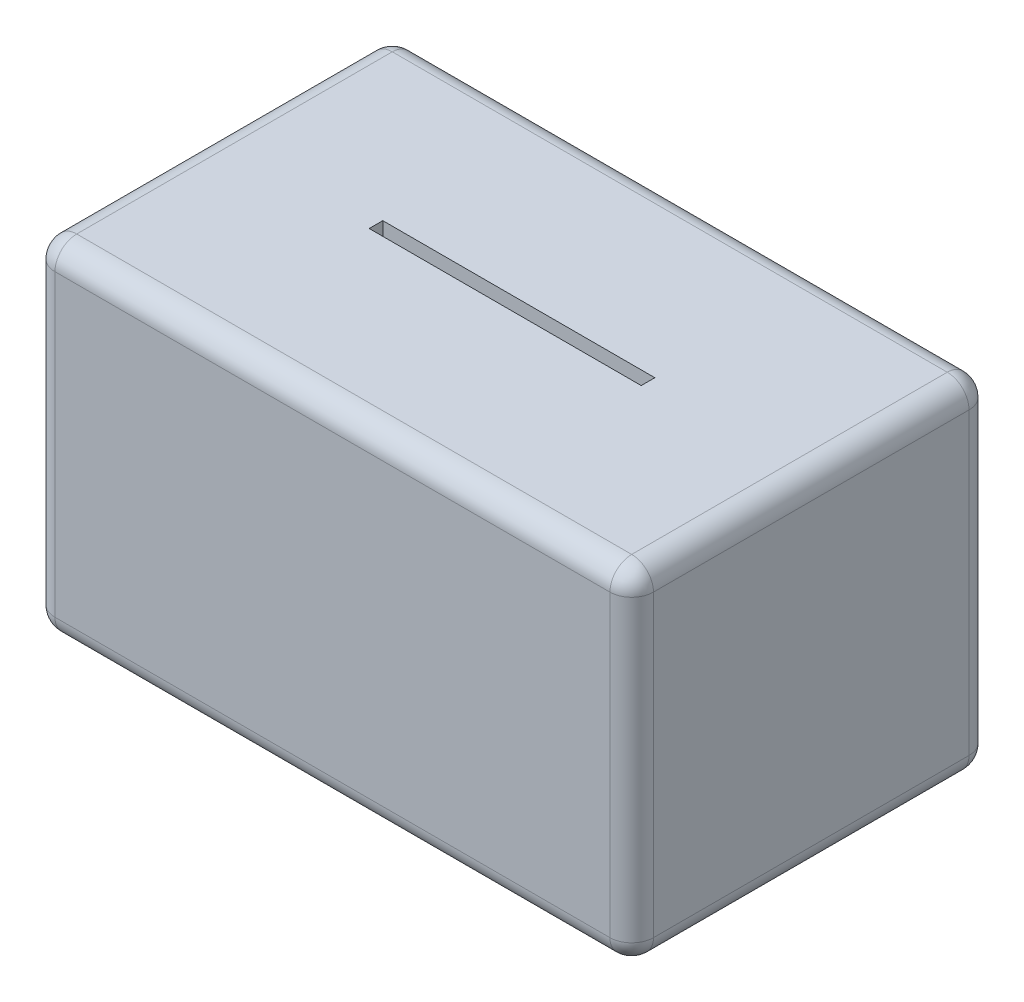
from build123d import *

# Parameters (mm, degrees)
SKETCH1_W           = 100
SKETCH1_H           = 60
BOSS_EXTRUDE1_DEPTH = 60
BOSS_EXTRUDE1_TAPER = 1
SHELL1_T            = -3
CHAMFER1_SIZE       = 2
CHAMFER1_SIZE_2     = 1.166633397
SKETCH2_W           = 100
SKETCH2_H           = 60
BOSS_EXTRUDE2_DEPTH = 3
SKETCH3_W           = 110
SKETCH3_H           = 66
SKETCH3_W_2         = 100
SKETCH3_H_2         = 60
BOSS_EXTRUDE3_DEPTH = 63
SKETCH4_W           = 50
SKETCH4_H           = 2.5
CUT_EXTRUDE1_DEPTH  = 3
FILLET1_R           = 4


with BuildPart() as part:
    # Sketch1 → Boss-Extrude1 (new body)
    with BuildSketch(Plane(origin=(0, 0, 0), x_dir=(1, 0, 0), z_dir=(0, 1, 0))):
        with Locations((50, 30)):
            Rectangle(SKETCH1_W, SKETCH1_H)
    extrude(amount=BOSS_EXTRUDE1_DEPTH, taper=BOSS_EXTRUDE1_TAPER)

    # Shell1
    shell1_openings = [part.faces().sort_by_distance(p)[0] for p in [
        (50, 60, -30),
    ]]
    offset(amount=SHELL1_T, openings=shell1_openings, kind=Kind.INTERSECTION)

    # Chamfer1
    # the kernel refuses this chamfer: 2, 1.166633397 mm, written as the material it takes off along each edge
    with BuildSketch(Plane(origin=(98.952696104, 60, 4.126867614), x_dir=(0.03677296874035604, -0.9993236456574119, 0), z_dir=(0, 0, -1)), Plane(origin=(1.047303896, 60, -64.126867614), x_dir=(-0.036772968740354815, -0.9993236456574122, 0), z_dir=(0, 0, 1))) as chamfer1_piece_1:
        Polygon((CHAMFER1_SIZE * 0.999813220622, CHAMFER1_SIZE * 0.0193267656127), (-CHAMFER1_SIZE_2 * 0.0367729687471, CHAMFER1_SIZE_2 * 0.999323645842), (0, 0), align=None)
    extrude(amount=68.253735227, mode=Mode.SUBTRACT)
    with BuildSketch(Plane(origin=(104.126867614, 60, -58.952696104), x_dir=(0, -0.9993236456574122, -0.036772968740352616), z_dir=(-1, 0, 0)), Plane(origin=(-4.126867614, 60, -1.047303896), x_dir=(0, -0.9993236456574119, 0.03677296874035481), z_dir=(1, 0, 0))) as chamfer1_piece_2:
        Polygon((CHAMFER1_SIZE * 0.999813220622, CHAMFER1_SIZE * 0.0193267656127), (-CHAMFER1_SIZE_2 * 0.0367729687471, CHAMFER1_SIZE_2 * 0.999323645842), (0, 0), align=None)
    extrude(amount=108.253735227, mode=Mode.SUBTRACT)


with BuildPart() as body_2:
    # Sketch2 → Boss-Extrude2 (new body)
    with BuildSketch(Plane(origin=(0, 60.2, 0), x_dir=(1, 0, 0), z_dir=(0, 1, 0))):
        with Locations((50, 30)):
            Rectangle(SKETCH2_W, SKETCH2_H)
    extrude(amount=BOSS_EXTRUDE2_DEPTH)


with BuildPart() as body_3:
    # Sketch3 → Boss-Extrude3 (new body)
    with BuildSketch(Plane(origin=(0, 63.2, 0), x_dir=(1, 0, 0), z_dir=(0, 1, 0))):
        with Locations((50, 30)):
            Rectangle(SKETCH3_W, SKETCH3_H)
        with Locations((50, 30)):
            Rectangle(SKETCH3_W_2, SKETCH3_H_2, mode=Mode.SUBTRACT)
    extrude(amount=-BOSS_EXTRUDE3_DEPTH)


with BuildPart() as body_2_1:
    add(body_2.part)

    # Combine1: union body 3
    add(body_3.part)

    # Sketch4 → Cut-Extrude1 (cut)
    with BuildSketch(Plane(origin=(0, 63.2, 0), x_dir=(1, 0, 0), z_dir=(0, 1, 0))):
        with Locations((50, 30)):
            Rectangle(SKETCH4_W, SKETCH4_H)
    extrude(amount=-CUT_EXTRUDE1_DEPTH, mode=Mode.SUBTRACT)

    # Fillet1
    # the kernel refuses this fillet: 4 mm, written as the material it takes off along each edge
    with BuildSketch(Plane(origin=(101, 4.2, -59), x_dir=(0, 0, -1), z_dir=(0, -1, 0))) as fillet1_piece_1_section:
        Polygon((0, 0), (FILLET1_R, 0), (FILLET1_R, FILLET1_R), (0, FILLET1_R), align=None)
    fillet1_piece_1 = extrude(amount=FILLET1_R, mode=Mode.PRIVATE)
    fillet1_piece_1 = fillet1_piece_1 - Plane(origin=(101, 4.2, -59), x_dir=(-0.7071067811865475, 0, 0.7071067811865475), z_dir=(0, -1, 0)) * Sphere(FILLET1_R, mode=Mode.PRIVATE)
    add(fillet1_piece_1, mode=Mode.SUBTRACT)
    with BuildSketch(Plane(origin=(101, 4.2, -1), x_dir=(1, 0, 0), z_dir=(0, -1, 0))) as fillet1_piece_2_section:
        Polygon((0, 0), (FILLET1_R, 0), (FILLET1_R, FILLET1_R), (0, FILLET1_R), align=None)
    fillet1_piece_2 = extrude(amount=FILLET1_R, mode=Mode.PRIVATE)
    fillet1_piece_2 = fillet1_piece_2 - Plane(origin=(101, 4.2, -1), x_dir=(-0.7071067811865475, 0, -0.7071067811865475), z_dir=(0, -1, 0)) * Sphere(FILLET1_R, mode=Mode.PRIVATE)
    add(fillet1_piece_2, mode=Mode.SUBTRACT)
    with BuildSketch(Plane(origin=(101, 59.2, -59), x_dir=(0, 0, -1), z_dir=(0, 1, 0))) as fillet1_piece_3_section:
        Polygon((0, 0), (FILLET1_R, 0), (FILLET1_R, -FILLET1_R), (0, -FILLET1_R), align=None)
    fillet1_piece_3 = extrude(amount=FILLET1_R, mode=Mode.PRIVATE)
    fillet1_piece_3 = fillet1_piece_3 - Plane(origin=(101, 59.2, -59), x_dir=(-0.7071067811865475, 0, 0.7071067811865475), z_dir=(0, 1, 0)) * Sphere(FILLET1_R, mode=Mode.PRIVATE)
    add(fillet1_piece_3, mode=Mode.SUBTRACT)
    with BuildSketch(Plane(origin=(101, 59.2, -1), x_dir=(1, 0, 0), z_dir=(0, 1, 0))) as fillet1_piece_4_section:
        Polygon((0, 0), (FILLET1_R, 0), (FILLET1_R, -FILLET1_R), (0, -FILLET1_R), align=None)
    fillet1_piece_4 = extrude(amount=FILLET1_R, mode=Mode.PRIVATE)
    fillet1_piece_4 = fillet1_piece_4 - Plane(origin=(101, 59.2, -1), x_dir=(-0.7071067811865475, 0, -0.7071067811865475), z_dir=(0, 1, 0)) * Sphere(FILLET1_R, mode=Mode.PRIVATE)
    add(fillet1_piece_4, mode=Mode.SUBTRACT)
    with BuildSketch(Plane(origin=(-1, 4.2, -1), x_dir=(0, 0, 1), z_dir=(0, -1, 0))) as fillet1_piece_5_section:
        Polygon((0, 0), (FILLET1_R, 0), (FILLET1_R, FILLET1_R), (0, FILLET1_R), align=None)
    fillet1_piece_5 = extrude(amount=FILLET1_R, mode=Mode.PRIVATE)
    fillet1_piece_5 = fillet1_piece_5 - Plane(origin=(-1, 4.2, -1), x_dir=(0.7071067811865475, 0, -0.7071067811865475), z_dir=(0, -1, 0)) * Sphere(FILLET1_R, mode=Mode.PRIVATE)
    add(fillet1_piece_5, mode=Mode.SUBTRACT)
    with BuildSketch(Plane(origin=(-1, 59.2, -1), x_dir=(0, 0, 1), z_dir=(0, 1, 0))) as fillet1_piece_6_section:
        Polygon((0, 0), (FILLET1_R, 0), (FILLET1_R, -FILLET1_R), (0, -FILLET1_R), align=None)
    fillet1_piece_6 = extrude(amount=FILLET1_R, mode=Mode.PRIVATE)
    fillet1_piece_6 = fillet1_piece_6 - Plane(origin=(-1, 59.2, -1), x_dir=(0.7071067811865475, 0, -0.7071067811865475), z_dir=(0, 1, 0)) * Sphere(FILLET1_R, mode=Mode.PRIVATE)
    add(fillet1_piece_6, mode=Mode.SUBTRACT)
    with BuildSketch(Plane(origin=(-1, 4.2, -59), x_dir=(0, 0, -1), z_dir=(0, -1, 0))) as fillet1_piece_7_section:
        Polygon((0, 0), (FILLET1_R, 0), (FILLET1_R, -FILLET1_R), (0, -FILLET1_R), align=None)
    fillet1_piece_7 = extrude(amount=FILLET1_R, mode=Mode.PRIVATE)
    fillet1_piece_7 = fillet1_piece_7 - Plane(origin=(-1, 4.2, -59), x_dir=(0.7071067811865475, 0, 0.7071067811865475), z_dir=(0, -1, 0)) * Sphere(FILLET1_R, mode=Mode.PRIVATE)
    add(fillet1_piece_7, mode=Mode.SUBTRACT)
    with BuildSketch(Plane(origin=(-1, 59.2, -59), x_dir=(0, 0, -1), z_dir=(0, 1, 0))) as fillet1_piece_8_section:
        Polygon((0, 0), (FILLET1_R, 0), (FILLET1_R, FILLET1_R), (0, FILLET1_R), align=None)
    fillet1_piece_8 = extrude(amount=FILLET1_R, mode=Mode.PRIVATE)
    fillet1_piece_8 = fillet1_piece_8 - Plane(origin=(-1, 59.2, -59), x_dir=(0.7071067811865475, 0, 0.7071067811865475), z_dir=(0, 1, 0)) * Sphere(FILLET1_R, mode=Mode.PRIVATE)
    add(fillet1_piece_8, mode=Mode.SUBTRACT)
    with BuildSketch(Plane(origin=(105, 0.2, -59), x_dir=(-1, 0, 0), z_dir=(0, 0, 1)), Plane(origin=(-5, 0.2, -1), x_dir=(1, 0, 0), z_dir=(0, 0, -1))) as fillet1_piece_9:
        with BuildLine():
            CenterArc((FILLET1_R, -FILLET1_R), FILLET1_R, 90, 90)
            Line((0, -FILLET1_R), (0, 0))
            Line((0, 0), (FILLET1_R, 0))
        make_face()
    extrude(amount=58, mode=Mode.SUBTRACT)
    with BuildSketch(Plane(origin=(105, 63.2, -59), x_dir=(-1, 0, 0), z_dir=(0, 0, 1)), Plane(origin=(-5, 63.2, -1), x_dir=(1, 0, 0), z_dir=(0, 0, -1))) as fillet1_piece_10:
        with BuildLine():
            CenterArc((FILLET1_R, FILLET1_R), FILLET1_R, 180, 90)
            Line((0, FILLET1_R), (0, 0))
            Line((0, 0), (FILLET1_R, 0))
        make_face()
    extrude(amount=58, mode=Mode.SUBTRACT)
    with BuildSketch(Plane(origin=(105, 59.2, 3), x_dir=(0, 0, -1), z_dir=(0, -1, 0)), Plane(origin=(105, 59.2, -63), x_dir=(-1, 0, 0), z_dir=(0, -1, 0)), Plane(origin=(-5, 59.2, 3), x_dir=(1, 0, 0), z_dir=(0, -1, 0))) as fillet1_piece_11:
        with BuildLine():
            CenterArc((FILLET1_R, -FILLET1_R), FILLET1_R, 90, 90)
            Line((0, -FILLET1_R), (0, 0))
            Line((0, 0), (FILLET1_R, 0))
        make_face()
    extrude(amount=55, mode=Mode.SUBTRACT)
    with BuildSketch(Plane(origin=(101, 0.2, 3), x_dir=(0, 0, -1), z_dir=(-1, 0, 0)), Plane(origin=(-1, 0.2, -63), x_dir=(0, 0, 1), z_dir=(1, 0, 0))) as fillet1_piece_12:
        with BuildLine():
            CenterArc((FILLET1_R, -FILLET1_R), FILLET1_R, 90, 90)
            Line((0, -FILLET1_R), (0, 0))
            Line((0, 0), (FILLET1_R, 0))
        make_face()
    extrude(amount=102, mode=Mode.SUBTRACT)
    with BuildSketch(Plane(origin=(101, 63.2, 3), x_dir=(0, 0, -1), z_dir=(-1, 0, 0)), Plane(origin=(-1, 63.2, -63), x_dir=(0, 0, 1), z_dir=(1, 0, 0))) as fillet1_piece_13:
        with BuildLine():
            CenterArc((FILLET1_R, FILLET1_R), FILLET1_R, 180, 90)
            Line((0, FILLET1_R), (0, 0))
            Line((0, 0), (FILLET1_R, 0))
        make_face()
    extrude(amount=102, mode=Mode.SUBTRACT)
    with BuildSketch(Plane(origin=(-5, 59.2, -63), x_dir=(1, 0, 0), z_dir=(0, -1, 0))) as fillet1_piece_14:
        with BuildLine():
            CenterArc((FILLET1_R, FILLET1_R), FILLET1_R, 180, 90)
            Line((0, FILLET1_R), (0, 0))
            Line((0, 0), (FILLET1_R, 0))
        make_face()
    extrude(amount=55, mode=Mode.SUBTRACT)


solid = Compound([part.part, body_2_1.part])
